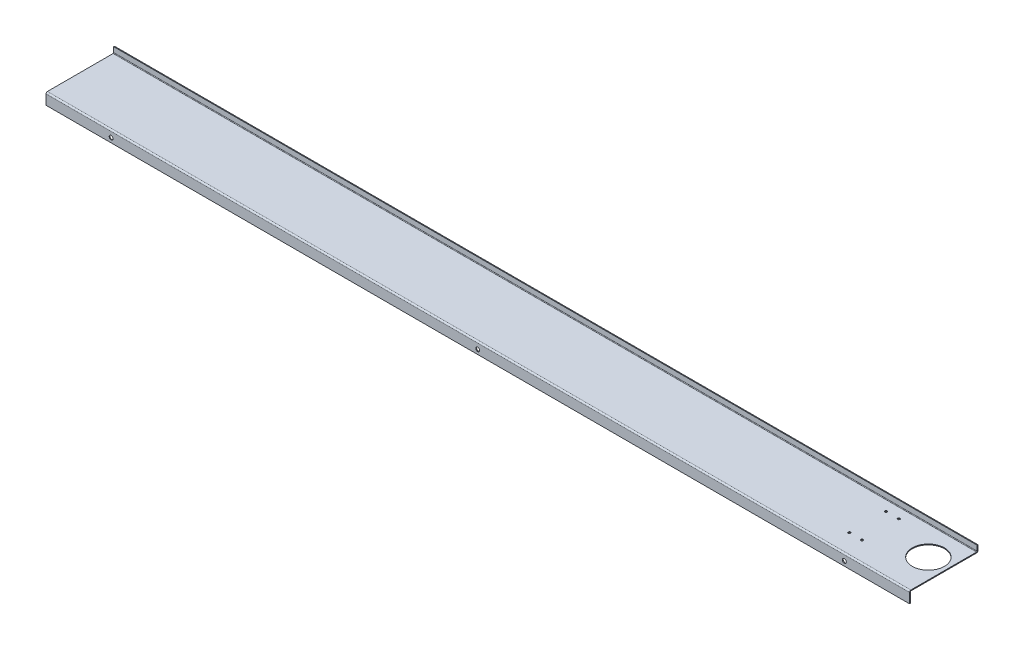
from build123d import *

# Parameters (mm, degrees)
SM_BASE_FLANGE_1_DEPTH = 765.5
HOLE_WIZARD_M6_1_D     = 7
HOLE_WIZARD_M5_1_D     = 4.2
HOLE_WIZARD_1_D        = 57


# Sheet-metal steps are written as plain solids
with BuildPart() as part:
    # Sketch 1 → 基体-法兰1 (new, symmetric)
    with BuildSketch(Plane(origin=(0, 0, 0), x_dir=(0, 0, -1), z_dir=(1, 0, 0))):
        with BuildLine():
            Line((0, 0), (0, 17.5))
            ThreePointArc((0, 17.5), (0.732233047, 19.267766953), (2.5, 20))
            Line((2.5, 20), (119, 20))
            ThreePointArc((119, 20), (119.707106781, 20.292893219), (120, 21))
            Line((120, 21), (120, 30))
            Line((120, 30), (121.5, 30))
            Line((121.5, 30), (121.5, 21))
            ThreePointArc((121.5, 21), (120.767766953, 19.232233047), (119, 18.5))
            Line((119, 18.5), (2.5, 18.5))
            ThreePointArc((2.5, 18.5), (1.792893219, 18.207106781), (1.5, 17.5))
            Line((1.5, 17.5), (1.5, 0))
            Line((1.5, 0), (0, 0))
        make_face()
    extrude(amount=SM_BASE_FLANGE_1_DEPTH, both=True)

    # M6 间隙孔1 (through all)
    with Locations(Plane(origin=(0, 0, -1.5), x_dir=(-1, 0, 0), z_dir=(0, 0, -1))):
        with Locations((-650, 8), (0, 8), (650, 8)):
            Hole(HOLE_WIZARD_M6_1_D / 2)

    # M5 螺纹孔1 (through all)
    with Locations(Plane(origin=(0, 20, 0), x_dir=(1, 0, 0), z_dir=(0, 1, 0))):
        with Locations((645.5, 36), (623, 36), (623, 101), (645.5, 101)):
            Hole(HOLE_WIZARD_M5_1_D / 2)

    # 孔1 (through all)
    with Locations(Plane(origin=(0, 20, 0), x_dir=(1, 0, 0), z_dir=(0, 1, 0))):
        with Locations((730.5, 68.5)):
            Hole(HOLE_WIZARD_1_D / 2)


solid = part.part
